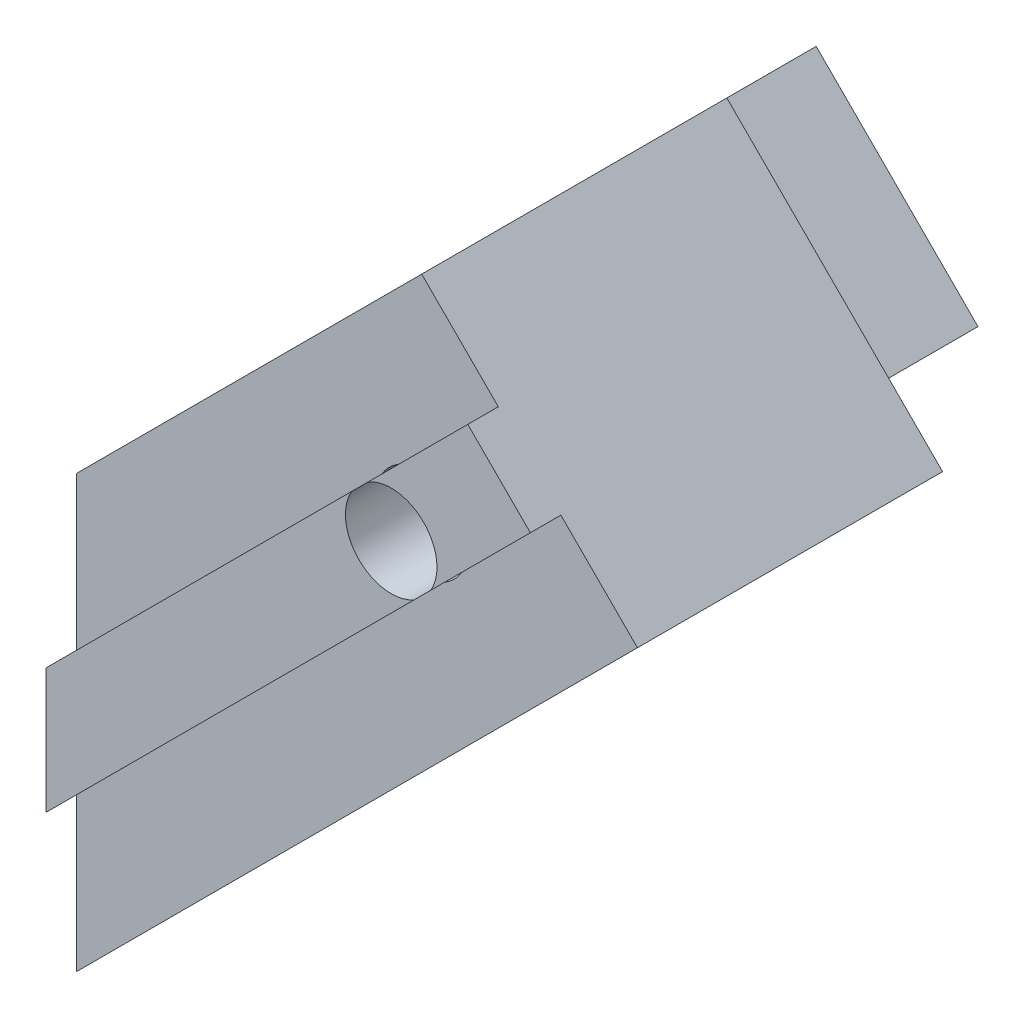
from build123d import *

# Parameters (mm, degrees)
BOSS_EXTRU_1_DEPTH       = 20
ESQUISSE2_W              = 10
ESQUISSE2_H              = 21
ENL_V_MAT_EXTRU_1_DEPTH  = 2.5
ESQUISSE3_R              = 1.5
ENL_V_MAT_EXTRU_2_DEPTH  = 38.732870983
ESQUISSE4_R              = 4
ENL_V_MAT_EXTRU_3_DEPTH  = 36.842591175
ESQUISSE5_R              = 1.25
ENL_V_MAT_EXTRU_4_DEPTH  = 37.976343789
BOSS_EXTRU_2_DEPTH       = 1
ESQUISSE7_R              = 1.5
ENL_V_MAT_EXTRU_5_DEPTH  = 38.775653535
ESQUISSE8_R              = 4
ENL_V_MAT_EXTRU_6_DEPTH  = 36.707142143
ENL_V_MAT_EXTRU_7_DEPTH  = 34.271609519
ENL_V_MAT_EXTRU_8_DEPTH  = 34.271609519
ESQUISSE11_R             = 4
ENL_V_MAT_EXTRU_11_DEPTH = 39.131991467


with BuildPart() as part:
    # Esquisse1 → Boss.-Extru.1 (new body)
    with BuildSketch(Plane.XY):
        Polygon((0, 0), (0, 5), (-1, 5), (-1, 7.9), (0, 7.9), (0, 14.142135624), (11.313708499, 25.455844123), (18.384776311, 18.384776311), align=None)
    extrude(amount=BOSS_EXTRU_1_DEPTH)

    # Esquisse2 → Enlèv. mat.-Extru.1 (cut)
    with BuildSketch(Plane(origin=(0, 0, 0), x_dir=(0, 0, -1), z_dir=(0.7071067811865512, -0.7071067811865438, 0))):
        with Locations((-5, 15.5)):
            Rectangle(ESQUISSE2_W, ESQUISSE2_H)
    extrude(amount=-ENL_V_MAT_EXTRU_1_DEPTH, mode=Mode.SUBTRACT)

    # Esquisse3 → Enlèv. mat.-Extru.2 (cut, through all)
    with BuildSketch(Plane.ZY.offset(1)):
        with Locations((15, 6.45)):
            Circle(ESQUISSE3_R)
    extrude(amount=-ENL_V_MAT_EXTRU_2_DEPTH, mode=Mode.SUBTRACT)

    # Esquisse4 → Enlèv. mat.-Extru.3 (cut, through all)
    with BuildSketch(Plane.ZY.offset(-3)):
        with Locations((15, 6.45)):
            Circle(ESQUISSE4_R)
    extrude(amount=-ENL_V_MAT_EXTRU_3_DEPTH, mode=Mode.SUBTRACT)

    # Esquisse5 → Enlèv. mat.-Extru.4 (cut, through all)
    with BuildSketch(Plane(origin=(-1.767766953, 1.767766953, 0), x_dir=(0, 0, -1), z_dir=(0.7071067811865513, -0.7071067811865438, 0))):
        with Locations((-5, 11.5)):
            Circle(ESQUISSE5_R)
    extrude(amount=-ENL_V_MAT_EXTRU_4_DEPTH, mode=Mode.SUBTRACT)

    # Esquisse6 → Boss.-Extru.2 (add)
    with BuildSketch(Plane.XY.offset(20)):
        Polygon((0, 9.121677477), (13.823937572, 22.94561505), (15.874547238, 20.895005384), (0, 5.020458146), align=None)
    extrude(amount=BOSS_EXTRU_2_DEPTH)

    # Esquisse7 → Enlèv. mat.-Extru.5 (cut, through all)
    with BuildSketch(Plane.XY.offset(21)):
        with Locations((11.313708499, 18.384776311)):
            Circle(ESQUISSE7_R)
    extrude(amount=-ENL_V_MAT_EXTRU_5_DEPTH, mode=Mode.SUBTRACT)

    # Esquisse8 → Enlèv. mat.-Extru.6 (cut, through all)
    with BuildSketch(Plane.XY.offset(17)):
        with Locations((11.313708499, 18.384776311)):
            Circle(ESQUISSE8_R)
    extrude(amount=-ENL_V_MAT_EXTRU_6_DEPTH, mode=Mode.SUBTRACT)

    # Esquisse9 → Enlèv. mat.-Extru.7 (cut, through all)
    with BuildSketch(Plane(origin=(0, 0, 10), x_dir=(-1, 0, 0), z_dir=(0, 0, -1))):
        Polygon((-18.384776311, 18.384776311), (-12.02081528, 12.02081528), (-4.949747468, 19.091883092), (-11.313708499, 25.455844123), align=None)
    extrude(amount=ENL_V_MAT_EXTRU_7_DEPTH, mode=Mode.SUBTRACT)

    # Esquisse10 → Enlèv. mat.-Extru.8 (cut, through all)
    with BuildSketch(Plane(origin=(0, 0, 10), x_dir=(-1, 0, 0), z_dir=(0, 0, -1))):
        Polygon((-11.313708499, 25.455844123), (-4.242640687, 18.384776311), (-11.313708499, 11.313708499), (-18.384776311, 18.384776311), align=None)
    extrude(amount=ENL_V_MAT_EXTRU_8_DEPTH, mode=Mode.SUBTRACT)

    # Esquisse11 → Enlèv. mat.-Extru.11 (cut, through all)
    with BuildSketch(Plane(origin=(-4.121320344, 2.949747468, 0), x_dir=(0, 0, 1), z_dir=(-0.7071067811865513, 0.7071067811865438, 0))):
        with Locations((5, 12.328427125)):
            Circle(ESQUISSE11_R)
    extrude(amount=ENL_V_MAT_EXTRU_11_DEPTH, mode=Mode.SUBTRACT)


solid = part.part
